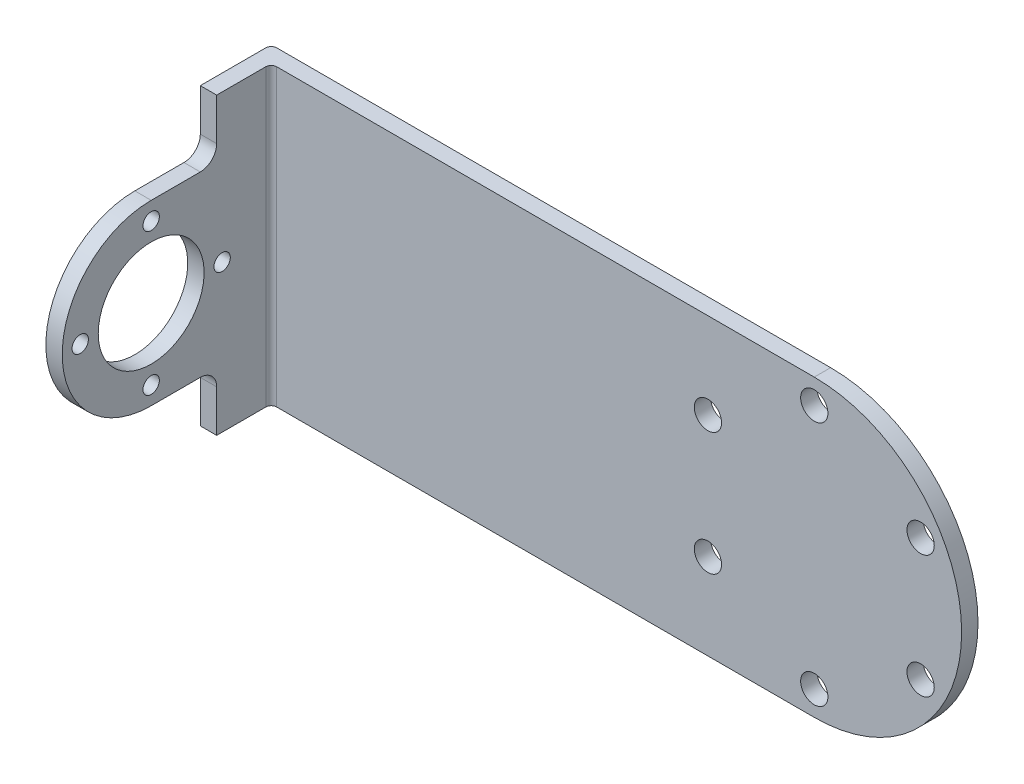
from build123d import *

# Parameters (mm, degrees)
SKETCH1_R           = 2.5
BOSS_EXTRUDE1_DEPTH = 3
SKETCH2_R           = 1.5
SKETCH2_R_2         = 9.7
BOSS_EXTRUDE2_DEPTH = 3
FILLET1_R           = 1


with BuildPart() as part:
    # Sketch1 → Boss-Extrude1 (new body)
    with BuildSketch(Plane.XY):
        with BuildLine():
            Line((0, 27), (-102.5, 27))
            Line((-102.5, 27), (-102.5, -27))
            Line((-102.5, -27), (0, -27))
            ThreePointArc((0, -27), (27, 0), (0, 27))
        make_face()
        with Locations((0, -22.5)):
            Circle(SKETCH1_R, mode=Mode.SUBTRACT)
        with Locations((-19.485571585, -11.25)):
            Circle(SKETCH1_R, mode=Mode.SUBTRACT)
        with Locations((19.485571585, -11.25)):
            Circle(SKETCH1_R, mode=Mode.SUBTRACT)
        with Locations((-19.485571585, 11.25)):
            Circle(SKETCH1_R, mode=Mode.SUBTRACT)
        with Locations((19.485571585, 11.25)):
            Circle(SKETCH1_R, mode=Mode.SUBTRACT)
        with Locations((0, 22.5)):
            Circle(SKETCH1_R, mode=Mode.SUBTRACT)
    extrude(amount=BOSS_EXTRUDE1_DEPTH)

    # Sketch2 → Boss-Extrude2 (add)
    with BuildSketch(Plane.ZY.offset(102.5)):
        with BuildLine():
            Line((3, 27), (3, -27))
            Line((3, -27), (13, -27))
            Line((13, -27), (13, -19.3))
            ThreePointArc((13, -19.3), (13.878679656, -17.178679656), (16, -16.3))
            Line((16, -16.3), (25, -16.3))
            ThreePointArc((25, -16.3), (41.3, 0), (25, 16.3))
            Line((25, 16.3), (16, 16.3))
            ThreePointArc((16, 16.3), (13.878679656, 17.178679656), (13, 19.3))
            Line((13, 19.3), (13, 27))
            Line((13, 27), (3, 27))
        make_face()
        with Locations((12, 0)):
            Circle(SKETCH2_R, mode=Mode.SUBTRACT)
        with Locations((25, -13)):
            Circle(SKETCH2_R, mode=Mode.SUBTRACT)
        with Locations((25, 0)):
            Circle(SKETCH2_R_2, mode=Mode.SUBTRACT)
        with Locations((25, 13)):
            Circle(SKETCH2_R, mode=Mode.SUBTRACT)
        with Locations((38, 0)):
            Circle(SKETCH2_R, mode=Mode.SUBTRACT)
    extrude(amount=-BOSS_EXTRUDE2_DEPTH)

    # Fillet1
    fillet1_edges = [part.edges().sort_by_distance(p)[0] for p in [
        (-99.5, 0, 3),
        (-102.5, 0, 0),
    ]]
    fillet(fillet1_edges, radius=FILLET1_R)


solid = part.part
